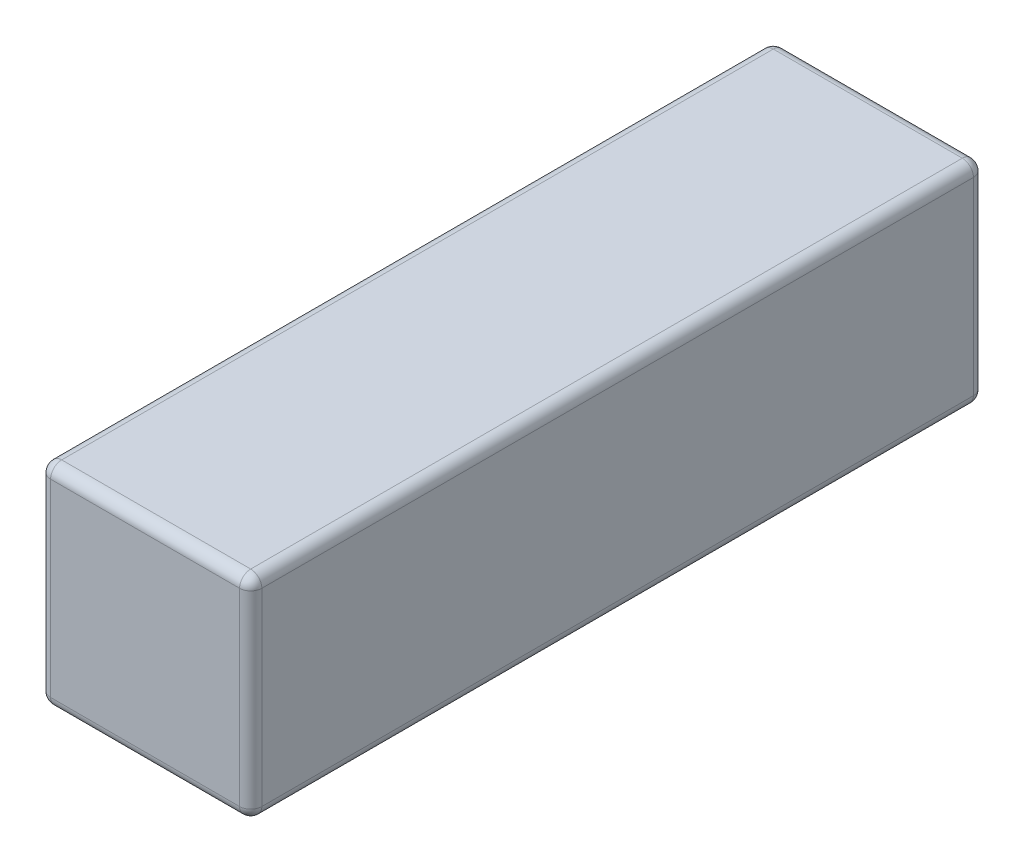
from build123d import *

# Parameters (mm, degrees)
SKETCH1_W           = 9.5
SKETCH1_H           = 9.5
BOSS_EXTRUDE1_DEPTH = 33
FILLET1_R           = 0.5


with BuildPart() as part:
    # Sketch1 → Boss-Extrude1 (new body)
    with BuildSketch(Plane.XY):
        Rectangle(SKETCH1_W, SKETCH1_H)
    extrude(amount=BOSS_EXTRUDE1_DEPTH)

    # Fillet1
    fillet1_edges = [part.edges().sort_by_distance(p)[0] for p in [
        (-4.75, 4.75, 16.5),
        (-4.75, -4.75, 16.5),
        (4.75, -4.75, 16.5),
        (4.75, 4.75, 16.5),
        (0, 4.75, 0),
        (4.75, 0, 0),
        (0, -4.75, 0),
        (-4.75, 0, 0),
        (-4.75, 0, 33),
        (0, -4.75, 33),
        (4.75, 0, 33),
        (0, 4.75, 33),
    ]]
    fillet(fillet1_edges, radius=FILLET1_R)


solid = part.part
